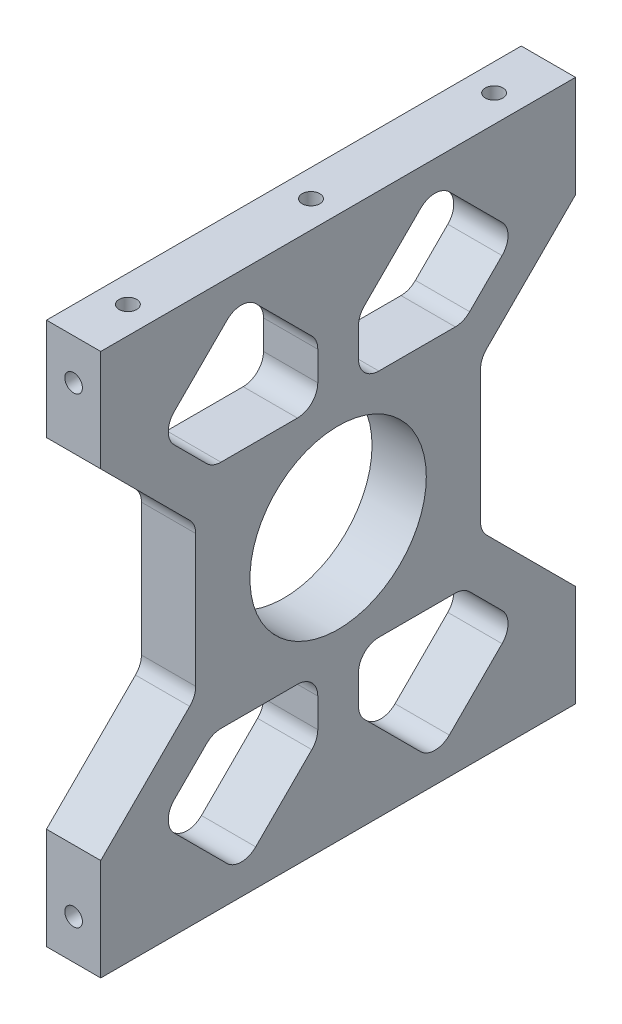
from build123d import *

# Parameters (mm, degrees)
SKETCH_1_W          = 70
SKETCH_1_H          = 80
EXTRUDE_1_DEPTH     = 8
SKETCH_4_R          = 13
CUT_EXTRUDE_2_DEPTH = 8
SKETCH_5_R          = 1.3
CUT_EXTRUDE_3_DEPTH = 10
SKETCH_6_R          = 1.3
CUT_EXTRUDE_4_DEPTH = 10
CUT_EXTRUDE_5_DEPTH = 10


with BuildPart() as part:
    # 草图1 → 凸台-拉伸1 (new body)
    with BuildSketch(Plane(origin=(0, 0, 0), x_dir=(0, 0, -1), z_dir=(1, 0, 0))):
        Rectangle(SKETCH_1_W, SKETCH_1_H)
    extrude(amount=EXTRUDE_1_DEPTH)

    # 草图4 → 切除-拉伸2 (cut)
    with BuildSketch(Plane(origin=(8, 0, 0), x_dir=(0, 0, -1), z_dir=(1, 0, 0))):
        Circle(SKETCH_4_R)
    extrude(amount=-CUT_EXTRUDE_2_DEPTH, mode=Mode.SUBTRACT)

    # 草图5 → 切除-拉伸3 (cut)
    with BuildSketch(Plane.XY.offset(35)):
        with Locations((4, 34)):
            Circle(SKETCH_5_R)
        with Locations((4, -34.156756408)):
            Circle(SKETCH_5_R)
    cut_extrude_3 = extrude(amount=-CUT_EXTRUDE_3_DEPTH, mode=Mode.SUBTRACT)

    # 镜向1: 切除-拉伸3 across plane
    add(cut_extrude_3.mirror(Plane.XY), mode=Mode.SUBTRACT)

    # 草图6 → 切除-拉伸4 (cut)
    with BuildSketch(Plane(origin=(0, 40, 0), x_dir=(1, 0, 0), z_dir=(0, 1, 0))):
        with Locations((4, 27)):
            Circle(SKETCH_6_R)
        with Locations((4, -27)):
            Circle(SKETCH_6_R)
        with Locations((4, 0)):
            Circle(SKETCH_6_R)
    cut_extrude_4 = extrude(amount=-CUT_EXTRUDE_4_DEPTH, mode=Mode.SUBTRACT)

    # 镜向2: 切除-拉伸4 across plane
    add(cut_extrude_4.mirror(Plane.ZX), mode=Mode.SUBTRACT)

    # 草图7 → 切除-拉伸5 (cut)
    with BuildSketch(Plane.ZY):
        with BuildLine():
            Line((-21.878679656, 11.878679656), (-35, 25))
            Line((-35, 25), (-35, -25))
            Line((-35, -25), (-21.878679656, -11.878679656))
            ThreePointArc((-21.878679656, -11.878679656), (-21.228361402, -10.90540961), (-21, -9.757359313))
            Line((-21, -9.757359313), (-21, 9.757359313))
            ThreePointArc((-21, 9.757359313), (-21.228361402, 10.90540961), (-21.878679656, 11.878679656))
        make_face()
        with BuildLine():
            Line((35, -25), (35, 25))
            Line((35, 25), (21.878679656, 11.878679656))
            ThreePointArc((21.878679656, 11.878679656), (21.228361402, 10.90540961), (21, 9.757359313))
            Line((21, 9.757359313), (21, -9.757359313))
            ThreePointArc((21, -9.757359313), (21.228361402, -10.90540961), (21.878679656, -11.878679656))
            Line((21.878679656, -11.878679656), (35, -25))
        make_face()
        with BuildLine():
            ThreePointArc((-12.150757595, 34.67766953), (-14.272077939, 35.556349186), (-16.393398282, 34.67766953))
            Line((-16.393398282, 34.67766953), (-24.171572875, 26.899494937))
            ThreePointArc((-24.171572875, 26.899494937), (-25.050252532, 24.778174593), (-24.171572875, 22.656854249))
            Line((-24.171572875, 22.656854249), (-19.393398282, 17.878679656))
            ThreePointArc((-19.393398282, 17.878679656), (-18.420128236, 17.228361402), (-17.272077939, 17))
            Line((-17.272077939, 17), (-6, 17))
            ThreePointArc((-6, 17), (-3.878679656, 17.878679656), (-3, 20))
            Line((-3, 20), (-3, 24.284271247))
            ThreePointArc((-3, 24.284271247), (-3.228361402, 25.432321545), (-3.878679656, 26.405591591))
            Line((-3.878679656, 26.405591591), (-12.150757595, 34.67766953))
        make_face()
        with BuildLine():
            Line((-12.150757595, -34.67766953), (-3.878679656, -26.405591591))
            ThreePointArc((-3.878679656, -26.405591591), (-3.228361402, -25.432321545), (-3, -24.284271247))
            Line((-3, -24.284271247), (-3, -20))
            ThreePointArc((-3, -20), (-3.878679656, -17.878679656), (-6, -17))
            Line((-6, -17), (-17.272077939, -17))
            ThreePointArc((-17.272077939, -17), (-18.420128236, -17.228361402), (-19.393398282, -17.878679656))
            Line((-19.393398282, -17.878679656), (-24.171572875, -22.656854249))
            ThreePointArc((-24.171572875, -22.656854249), (-25.050252532, -24.778174593), (-24.171572875, -26.899494937))
            Line((-24.171572875, -26.899494937), (-16.393398282, -34.67766953))
            ThreePointArc((-16.393398282, -34.67766953), (-14.272077939, -35.556349186), (-12.150757595, -34.67766953))
        make_face()
        with BuildLine():
            ThreePointArc((12.150757595, -34.67766953), (14.272077939, -35.556349186), (16.393398282, -34.67766953))
            Line((16.393398282, -34.67766953), (24.171572875, -26.899494937))
            ThreePointArc((24.171572875, -26.899494937), (25.050252532, -24.778174593), (24.171572875, -22.656854249))
            Line((24.171572875, -22.656854249), (19.393398282, -17.878679656))
            ThreePointArc((19.393398282, -17.878679656), (18.420128236, -17.228361402), (17.272077939, -17))
            Line((17.272077939, -17), (6, -17))
            ThreePointArc((6, -17), (3.878679656, -17.878679656), (3, -20))
            Line((3, -20), (3, -24.284271247))
            ThreePointArc((3, -24.284271247), (3.228361402, -25.432321545), (3.878679656, -26.405591591))
            Line((3.878679656, -26.405591591), (12.150757595, -34.67766953))
        make_face()
        with BuildLine():
            Line((12.150757595, 34.67766953), (3.878679656, 26.405591591))
            ThreePointArc((3.878679656, 26.405591591), (3.228361402, 25.432321545), (3, 24.284271247))
            Line((3, 24.284271247), (3, 20))
            ThreePointArc((3, 20), (3.878679656, 17.878679656), (6, 17))
            Line((6, 17), (17.272077939, 17))
            ThreePointArc((17.272077939, 17), (18.420128236, 17.228361402), (19.393398282, 17.878679656))
            Line((19.393398282, 17.878679656), (24.171572875, 22.656854249))
            ThreePointArc((24.171572875, 22.656854249), (25.050252532, 24.778174593), (24.171572875, 26.899494937))
            Line((24.171572875, 26.899494937), (16.393398282, 34.67766953))
            ThreePointArc((16.393398282, 34.67766953), (14.272077939, 35.556349186), (12.150757595, 34.67766953))
        make_face()
    extrude(amount=-CUT_EXTRUDE_5_DEPTH, mode=Mode.SUBTRACT)


solid = part.part
